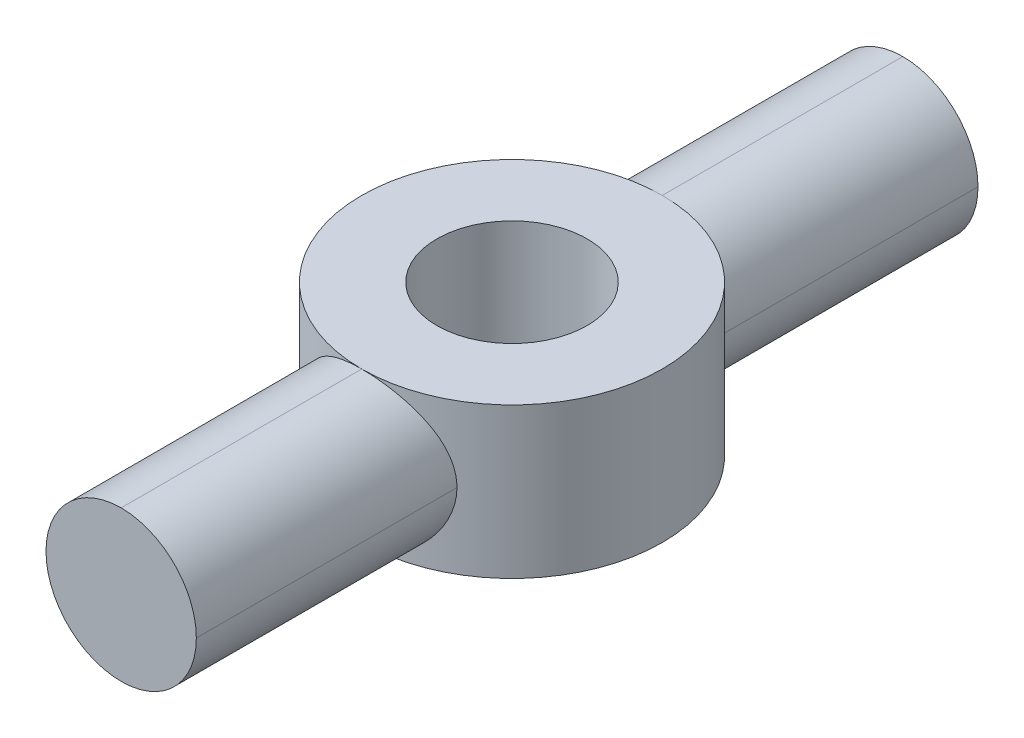
from build123d import *

# Parameters (mm, degrees)
ESBO_O1_R                = 12.5
RESSALTO_EXTRUS_O1_DEPTH = 25
FILETE1_R                = 12.5


with BuildPart() as part:
    # Esboço1 → Ressalto-extrusão1 (new body)
    with BuildSketch(Plane(origin=(0, 0, 0), x_dir=(1, 0, 0), z_dir=(0, 1, 0))):
        with BuildLine():
            Line((-12.5, -21.650635095), (-12.5, -65))
            Line((-12.5, -65), (12.5, -65))
            Line((12.5, -65), (12.5, -21.650635095))
            ThreePointArc((12.5, -21.650635095), (25, 0), (12.5, 21.650635095))
            Line((12.5, 21.650635095), (12.5, 65))
            Line((12.5, 65), (-12.5, 65))
            Line((-12.5, 65), (-12.5, 21.650635095))
            ThreePointArc((-12.5, 21.650635095), (-25, 0), (-12.5, -21.650635095))
        make_face()
        with Locations(Location((0, 0, 0), (0, 0, 270))):
            Circle(ESBO_O1_R, mode=Mode.SUBTRACT)
    extrude(amount=RESSALTO_EXTRUS_O1_DEPTH)

    # Filete1
    filete1_edges = [part.edges().sort_by_distance(p)[0] for p in [
        (-12.5, 0, -43.325317547),
        (12.5, 0, -43.325317547),
        (-12.5, 25, -43.325317547),
        (12.5, 25, -43.325317547),
        (-12.5, 0, 43.325317547),
        (12.5, 0, 43.325317547),
        (12.5, 25, 43.325317547),
        (-12.5, 25, 43.325317547),
    ]]
    fillet(filete1_edges, radius=FILETE1_R - 0.0001)  # a hair under: the kernel refuses the full size


solid = part.part
